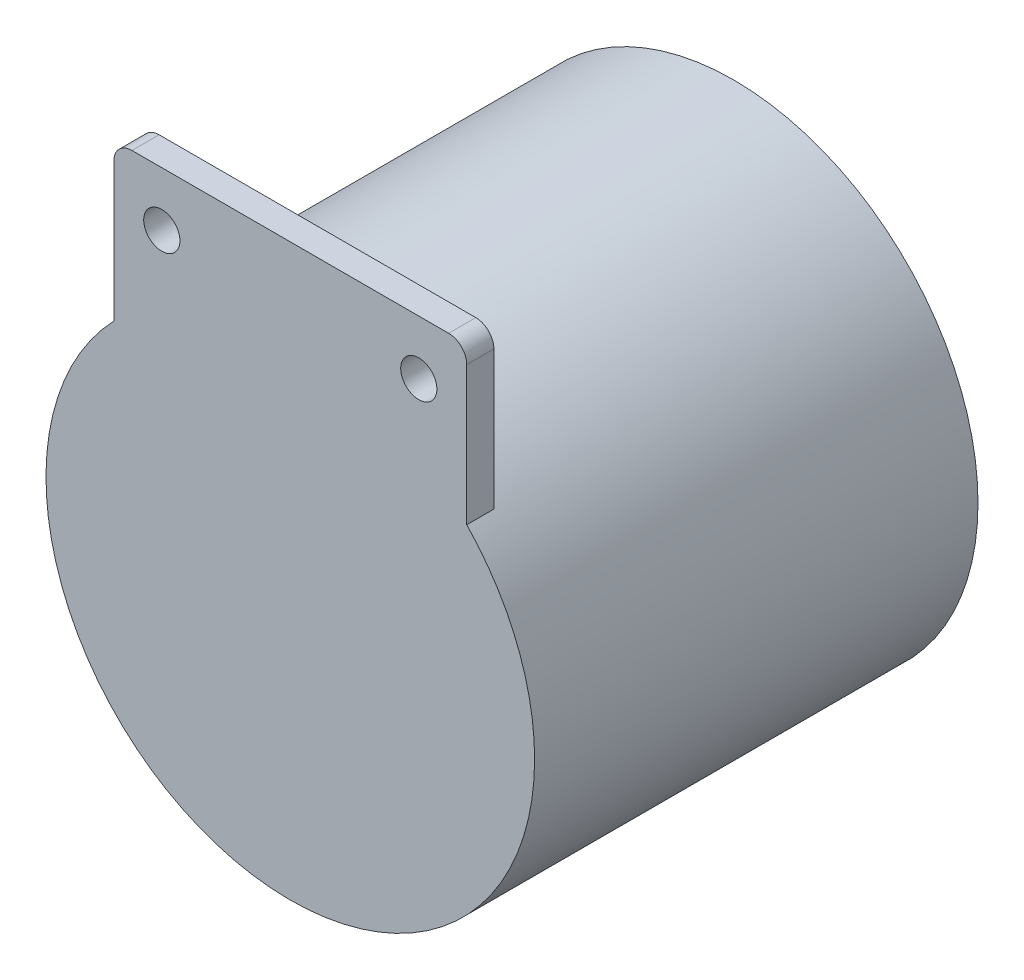
from build123d import *

# Parameters (mm, degrees)
ESQUISSE1_R        = 27
BOSS_EXTRU_1_DEPTH = 49
ESQUISSE2_R        = 2
BOSS_EXTRU_2_DEPTH = 3
CONG_1_R           = 2


with BuildPart() as part:
    # Esquisse1 → Boss.-Extru.1 (new body)
    with BuildSketch(Plane.XY):
        Circle(ESQUISSE1_R)
    extrude(amount=-BOSS_EXTRU_1_DEPTH)

    # Esquisse2 → Boss.-Extru.2 (add)
    with BuildSketch(Plane.XY):
        with BuildLine():
            Line((-19.5, 18.674849397), (-19.5, 36))
            Line((-19.5, 36), (19.5, 36))
            Line((19.5, 36), (19.5, 18.674849397))
            ThreePointArc((19.5, 18.674849397), (0, 27), (-19.5, 18.674849397))
        make_face()
        with Locations((-14.2, 30)):
            Circle(ESQUISSE2_R, mode=Mode.SUBTRACT)
        with Locations((14.2, 30)):
            Circle(ESQUISSE2_R, mode=Mode.SUBTRACT)
    extrude(amount=-BOSS_EXTRU_2_DEPTH)

    # Congé1
    cong_1_edges = [part.edges().sort_by_distance(p)[0] for p in [
        (-19.5, 36, -1.5),
        (19.5, 36, -1.5),
    ]]
    fillet(cong_1_edges, radius=CONG_1_R)


solid = part.part
